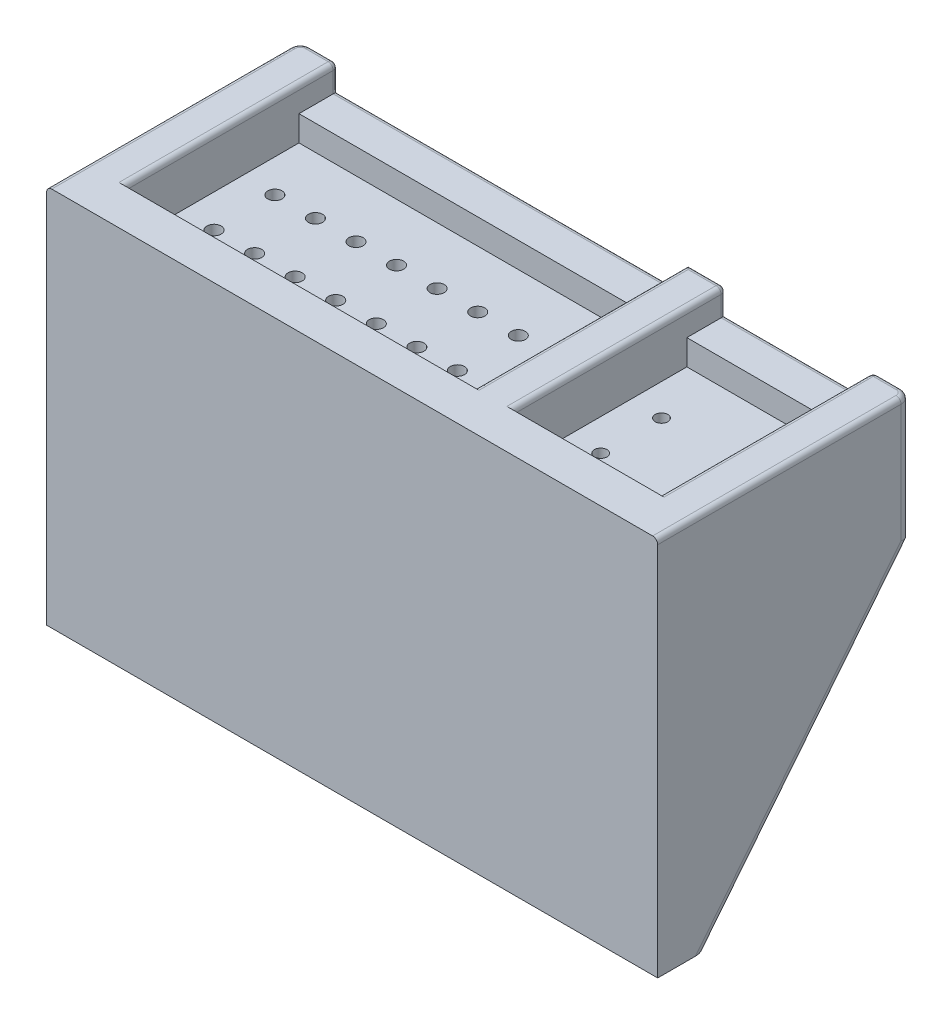
from build123d import *

# Parameters (mm, degrees)
SKETCH1_W           = 120.5
SKETCH1_H           = 50
BOSS_EXTRUDE1_DEPTH = 25
SKETCH2_W           = 29
SKETCH2_H           = 34.5
CUT_EXTRUDE1_DEPTH  = 10
SKETCH3_W           = 69
SKETCH3_H           = 34.5
CUT_EXTRUDE2_DEPTH  = 10
SKETCH5_R           = 1.4
CUT_EXTRUDE4_DEPTH  = 67.933269007
SKETCH6_R           = 1.25
CUT_EXTRUDE5_DEPTH  = 67.933269007
SKETCH8_W           = 69
SKETCH8_H           = 7.75
SKETCH8_W_2         = 29
CUT_EXTRUDE7_DEPTH  = 5
FILLET1_R           = 1
SKETCH9_W           = 120.5
SKETCH9_H           = 10
BOSS_EXTRUDE2_DEPTH = 50
BOSS_EXTRUDE3_DEPTH = 10
FILLET3_R           = 2


with BuildPart() as part:
    # Sketch1 → Boss-Extrude1 (new body)
    with BuildSketch(Plane(origin=(0, 0, 0), x_dir=(1, 0, 0), z_dir=(0, 1, 0))):
        Rectangle(SKETCH1_W, SKETCH1_H)
    extrude(amount=BOSS_EXTRUDE1_DEPTH)

    # Sketch2 → Cut-Extrude1 (cut)
    with BuildSketch(Plane(origin=(0, 25, 0), x_dir=(1, 0, 0), z_dir=(0, 1, 0))):
        with Locations((38.25, 0)):
            Rectangle(SKETCH2_W, SKETCH2_H)
    extrude(amount=-CUT_EXTRUDE1_DEPTH, mode=Mode.SUBTRACT)

    # Sketch3 → Cut-Extrude2 (cut)
    with BuildSketch(Plane(origin=(0, 25, 0), x_dir=(1, 0, 0), z_dir=(0, 1, 0))):
        with Locations((-18.25, 0)):
            Rectangle(SKETCH3_W, SKETCH3_H)
    extrude(amount=-CUT_EXTRUDE2_DEPTH, mode=Mode.SUBTRACT)

    # Sketch5 → Cut-Extrude4 (cut, through all)
    with BuildSketch(Plane(origin=(0, 15, 0), x_dir=(1, 0, 0), z_dir=(0, 1, 0))):
        with Locations(Location((-46.25, 6, 0), (0, 0, 270))):
            Circle(SKETCH5_R)
        with Locations(Location((-38.25, 6, 0), (0, 0, 270))):
            Circle(SKETCH5_R)
        with Locations(Location((-30.25, 6, 0), (0, 0, 270))):
            Circle(SKETCH5_R)
        with Locations(Location((-22.25, 6, 0), (0, 0, 270))):
            Circle(SKETCH5_R)
        with Locations(Location((-14.25, 6, 0), (0, 0, 270))):
            Circle(SKETCH5_R)
        with Locations(Location((-6.25, 6, 0), (0, 0, 270))):
            Circle(SKETCH5_R)
        with Locations(Location((1.75, 6, 0), (0, 0, 270))):
            Circle(SKETCH5_R)
        with Locations(Location((9.75, 6, 0), (0, 0, 270))):
            Circle(SKETCH5_R)
        with Locations(Location((-38.25, -6, 0), (0, 0, 270))):
            Circle(SKETCH5_R)
        with Locations(Location((-30.25, -6, 0), (0, 0, 270))):
            Circle(SKETCH5_R)
        with Locations(Location((-22.25, -6, 0), (0, 0, 270))):
            Circle(SKETCH5_R)
        with Locations(Location((-14.25, -6, 0), (0, 0, 270))):
            Circle(SKETCH5_R)
        with Locations(Location((-6.25, -6, 0), (0, 0, 270))):
            Circle(SKETCH5_R)
        with Locations(Location((1.75, -6, 0), (0, 0, 270))):
            Circle(SKETCH5_R)
        with Locations(Location((9.75, -6, 0), (0, 0, 270))):
            Circle(SKETCH5_R)
        with Locations(Location((-46.25, -6, 0), (0, 0, 270))):
            Circle(SKETCH5_R)
    extrude(amount=-CUT_EXTRUDE4_DEPTH, mode=Mode.SUBTRACT)

    # Sketch6 → Cut-Extrude5 (cut, through all)
    with BuildSketch(Plane(origin=(0, 15, 0), x_dir=(1, 0, 0), z_dir=(0, 1, 0))):
        with Locations(Location((30, 6, 0), (0, 0, 270))):
            Circle(SKETCH6_R)
        with Locations(Location((46, 6, 0), (0, 0, 270))):
            Circle(SKETCH6_R)
    cut_extrude5 = extrude(amount=-CUT_EXTRUDE5_DEPTH, mode=Mode.SUBTRACT)

    # Mirror3: Cut-Extrude5 across plane
    add(cut_extrude5.mirror(Plane.XY), mode=Mode.SUBTRACT)

    # Sketch8 → Cut-Extrude7 (cut)
    with BuildSketch(Plane(origin=(0, 25, 0), x_dir=(1, 0, 0), z_dir=(0, 1, 0))):
        with Locations((-18.25, 21.125)):
            Rectangle(SKETCH8_W, SKETCH8_H)
        with Locations((38.25, 21.125)):
            Rectangle(SKETCH8_W_2, SKETCH8_H)
    extrude(amount=-CUT_EXTRUDE7_DEPTH, mode=Mode.SUBTRACT)

    # Fillet1
    fillet1_edges = [part.edges().sort_by_distance(p)[0] for p in [
        (20, 25, -25),
        (-60.25, 25, 0),
        (-56.5, 25, -25),
        (-18.25, 20, -25),
        (-52.75, 22.5, -25),
        (38.25, 20, -25),
        (23.75, 22.5, -25),
        (52.75, 22.5, -25),
        (52.75, 25, -3.875),
        (23.75, 25, -3.875),
        (16.25, 25, -3.875),
        (-52.75, 25, -3.875),
        (60.25, 25, 0),
        (56.5, 25, -25),
    ]]
    fillet(fillet1_edges, radius=FILLET1_R)

    # Sketch9 → Boss-Extrude2 (add)
    with BuildSketch(Plane.XZ):
        with Locations((0, 20)):
            Rectangle(SKETCH9_W, SKETCH9_H)
    extrude(amount=BOSS_EXTRUDE2_DEPTH)

    # Sketch10 → Boss-Extrude3 (add)
    with BuildSketch(Plane.ZY.offset(60.25)):
        Polygon((-25, 0), (15, -50), (15, 0), align=None)
    boss_extrude3 = extrude(amount=-BOSS_EXTRUDE3_DEPTH)

    # Mirror4: Boss-Extrude3 across plane
    add(boss_extrude3.mirror(Plane(origin=(0, 0, 0), x_dir=(0, 0, 1), z_dir=(1, 0, 0))))

    # Fillet3
    # the kernel refuses this fillet: 2 mm, written as the material it takes off along each edge
    with BuildSketch(Plane(origin=(58.25, 25, -23), x_dir=(1, 0, 0), z_dir=(0, 0, 1))) as fillet3_piece_1:
        with BuildLine():
            CenterArc((1, -1), 1, 0, 90)
            Line((2, -1), (2, 0))
            Line((2, 0), (1, 0))
        make_face()
    revolve(axis=Axis((58.25, 25, -23), (0, 1, 0)), revolution_arc=90, mode=Mode.SUBTRACT)
    with BuildSketch(Plane(origin=(-58.25, 25, -23), x_dir=(0, 0, -1), z_dir=(1, 0, 0))) as fillet3_piece_2:
        with BuildLine():
            CenterArc((1, -1), 1, 0, 90)
            Line((2, -1), (2, 0))
            Line((2, 0), (1, 0))
        make_face()
    revolve(axis=Axis((-58.25, 25, -23), (0, 1, 0)), revolution_arc=90, mode=Mode.SUBTRACT)
    with BuildSketch(Plane(origin=(60.25, -5, -25), x_dir=(0, 0, 1), z_dir=(0, 1, 0))) as fillet3_piece_3:
        with BuildLine():
            CenterArc((FILLET3_R, -FILLET3_R), FILLET3_R, 90, 90)
            Line((0, -FILLET3_R), (0, 0))
            Line((0, 0), (FILLET3_R, 0))
        make_face()
    extrude(amount=30, mode=Mode.SUBTRACT)
    with BuildSketch(Plane(origin=(-60.25, -5, -25), x_dir=(0, 0, 1), z_dir=(0, 1, 0))) as fillet3_piece_4:
        with BuildLine():
            CenterArc((FILLET3_R, FILLET3_R), FILLET3_R, 180, 90)
            Line((0, FILLET3_R), (0, 0))
            Line((0, 0), (FILLET3_R, 0))
        make_face()
    extrude(amount=30, mode=Mode.SUBTRACT)
    with BuildSketch(Plane(origin=(-50.25, 3.904344047, -28.123475238), x_dir=(-1, 0, 0), z_dir=(0, -0.7808688094430305, 0.6246950475544242))) as fillet3_piece_5_section:
        with BuildLine():
            CenterArc((FILLET3_R, -FILLET3_R), FILLET3_R, 90, 90)
            Line((0, -FILLET3_R), (0, 0))
            Line((0, 0), (FILLET3_R, 0))
        make_face()
    fillet3_piece_5 = extrude(amount=74.031242374, mode=Mode.PRIVATE)
    fillet3_piece_5 = split(fillet3_piece_5, bisect_by=Plane(origin=(-50.699423068, -24.646092888, 15), z_dir=(0, 0, -1)), keep=Keep.TOP, mode=Mode.PRIVATE)
    fillet3_piece_5 = split(fillet3_piece_5, bisect_by=Plane(origin=(-50.699423068, 0, -4.716874311), z_dir=(0, -1, 0)), keep=Keep.TOP, mode=Mode.PRIVATE)
    add(fillet3_piece_5, mode=Mode.SUBTRACT)
    with BuildSketch(Plane(origin=(-60.25, 3.904344047, -28.123475238), x_dir=(0, 0.6246950475544242, 0.7808688094430305), z_dir=(0, -0.7808688094430305, 0.6246950475544242))) as fillet3_piece_6:
        with BuildLine():
            CenterArc((FILLET3_R, -FILLET3_R), FILLET3_R, 90, 90)
            Line((0, -FILLET3_R), (0, 0))
            Line((0, 0), (FILLET3_R, 0))
        make_face()
    extrude(amount=74.031242374, mode=Mode.SUBTRACT)
    with BuildSketch(Plane(origin=(60.25, 3.904344047, -28.123475238), x_dir=(0, 0.6246950475544242, 0.7808688094430305), z_dir=(0, -0.7808688094430305, 0.6246950475544242))) as fillet3_piece_7:
        with BuildLine():
            CenterArc((FILLET3_R, FILLET3_R), FILLET3_R, 180, 90)
            Line((0, FILLET3_R), (0, 0))
            Line((0, 0), (FILLET3_R, 0))
        make_face()
    extrude(amount=74.031242374, mode=Mode.SUBTRACT)
    with BuildSketch(Plane(origin=(50.25, 3.904344047, -28.123475238), x_dir=(1, 0, 0), z_dir=(0, -0.7808688094430305, 0.6246950475544242))) as fillet3_piece_8_section:
        with BuildLine():
            CenterArc((FILLET3_R, FILLET3_R), FILLET3_R, 180, 90)
            Line((0, FILLET3_R), (0, 0))
            Line((0, 0), (FILLET3_R, 0))
        make_face()
    fillet3_piece_8 = extrude(amount=74.031242374, mode=Mode.PRIVATE)
    fillet3_piece_8 = split(fillet3_piece_8, bisect_by=Plane(origin=(50.699423068, -24.646092888, 15), z_dir=(0, 0, -1)), keep=Keep.TOP, mode=Mode.PRIVATE)
    fillet3_piece_8 = split(fillet3_piece_8, bisect_by=Plane(origin=(50.699423068, 0, -4.716874311), z_dir=(0, -1, 0)), keep=Keep.TOP, mode=Mode.PRIVATE)
    add(fillet3_piece_8, mode=Mode.SUBTRACT)


solid = part.part
